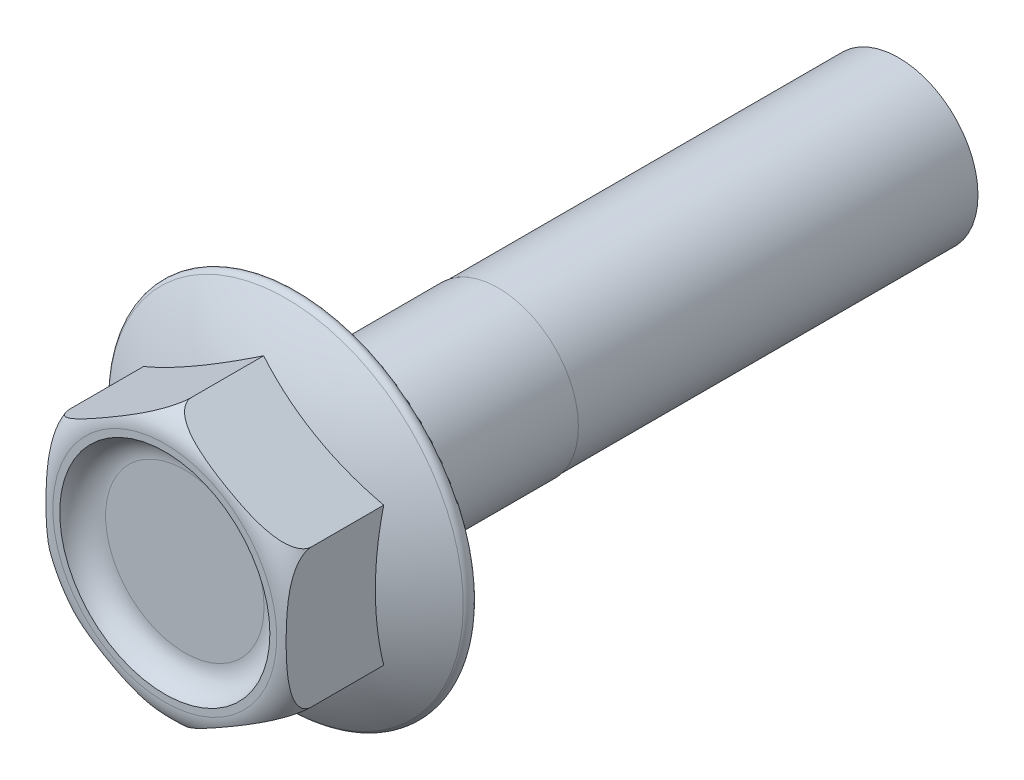
from build123d import *

# Parameters (mm, degrees)
HEAD_DEPTH     = 10
SHANK_SKETCH_R = 6
SHANK_DEPTH    = 45
SKETCH6_R      = 7.875
HEAD_CUT_DEPTH = 1.5
FILLET1_R      = 2
FILLET2_R      = 0.5
THREAD_END_W   = 30
THREAD_END_H   = 0.05


with BuildPart() as part:
    # Head Sketch → Head (new body)
    with BuildSketch(Plane.XY):
        Polygon((0, 10.392304845), (9, 5.196152423), (9, -5.196152423), (0, -10.392304845), (-9, -5.196152423), (-9, 5.196152423), align=None)
    extrude(amount=HEAD_DEPTH)

    # Shank Sketch → Shank (add)
    with BuildSketch(Plane.XY):
        Circle(SHANK_SKETCH_R)
    extrude(amount=-SHANK_DEPTH)

    # Sketch3 → Flange (revolve)
    with BuildSketch(Plane(origin=(0, 0, 0), x_dir=(-1, 0, 0), z_dir=(0, 1, 0)), mode=Mode.PRIVATE) as flange_sk:
        with BuildLine():
            Line((-13, 0), (0, 0))
            Line((0, 0), (0, 5))
            ThreePointArc((0, 5), (-6.947778179, 3.955279081), (-13.281081081, 0.913513514))
            ThreePointArc((-13.281081081, 0.913513514), (-13.477889504, 0.352957076), (-13, 0))
        make_face()
    revolve(flange_sk.sketch.rotate(Axis((0, 0, 0), (0, 0, 1)), 30), axis=Axis((0, 0, 0), (0, 0, 1)))

    # Sketch5 → Head Trim (revolve, cut)
    with BuildSketch(Plane(origin=(0, 0, 0), x_dir=(0, 0, -1), z_dir=(1, 0, 0)), mode=Mode.PRIVATE) as head_trim_sk:
        with BuildLine():
            Line((-10, -8.392304845), (-10, -10.392304845))
            Line((-10, -10.392304845), (-8, -10.392304845))
            ThreePointArc((-8, -10.392304845), (-9.414213562, -9.806518408), (-10, -8.392304845))
        make_face()
    revolve(head_trim_sk.sketch.rotate(Axis((0, 0, 15.085599173), (0, 0, -1)), 90), axis=Axis((0, 0, 15.085599173), (0, 0, -1)), mode=Mode.SUBTRACT)

    # Sketch6 → Head Cut (cut)
    with BuildSketch(Plane.XY.offset(10)):
        Circle(SKETCH6_R)
    extrude(amount=-HEAD_CUT_DEPTH, mode=Mode.SUBTRACT)

    # Fillet1
    # the kernel refuses this fillet: 2 mm, written as the material it adds along each edge
    with BuildSketch(Plane(origin=(0, 0, 8.5), x_dir=(1, 0, 0), z_dir=(0, -1, 0))) as fillet1_piece_1:
        with BuildLine():
            CenterArc((5.938508327, 2), FILLET1_R, 270, 75.522487814)
            Line((5.938508327, 0), (5.938508327, -0.04))
            Line((5.938508327, -0.04), (7.875, -0.04))
            Line((7.875, -0.04), (7.915, 0))
            ThreePointArc((7.915, 0), (7.915, 0.75), (7.913729833, 1.49))
            Line((7.913729833, 1.49), (7.875, 1.5))
        make_face()
    revolve(axis=Axis((0, 0, 8.5), (0, 0, 1)))

    # Fillet2
    fillet2_edges = [part.edges().sort_by_distance(p)[0] for p in [
        (-6, 0, 0),
    ]]
    fillet(fillet2_edges, radius=FILLET2_R)

    # Thread End → Thread Cut (revolve, cut)
    with BuildSketch(Plane(origin=(0, 0, 0), x_dir=(0, 0, -1), z_dir=(1, 0, 0)), mode=Mode.PRIVATE) as thread_cut_sk:
        with Locations((30, 5.975)):
            Rectangle(THREAD_END_W, THREAD_END_H)
    revolve(thread_cut_sk.sketch.rotate(Axis((0, 0, -21.551935625), (0, 0, -1)), 90), axis=Axis((0, 0, -21.551935625), (0, 0, -1)), mode=Mode.SUBTRACT)


solid = part.part
